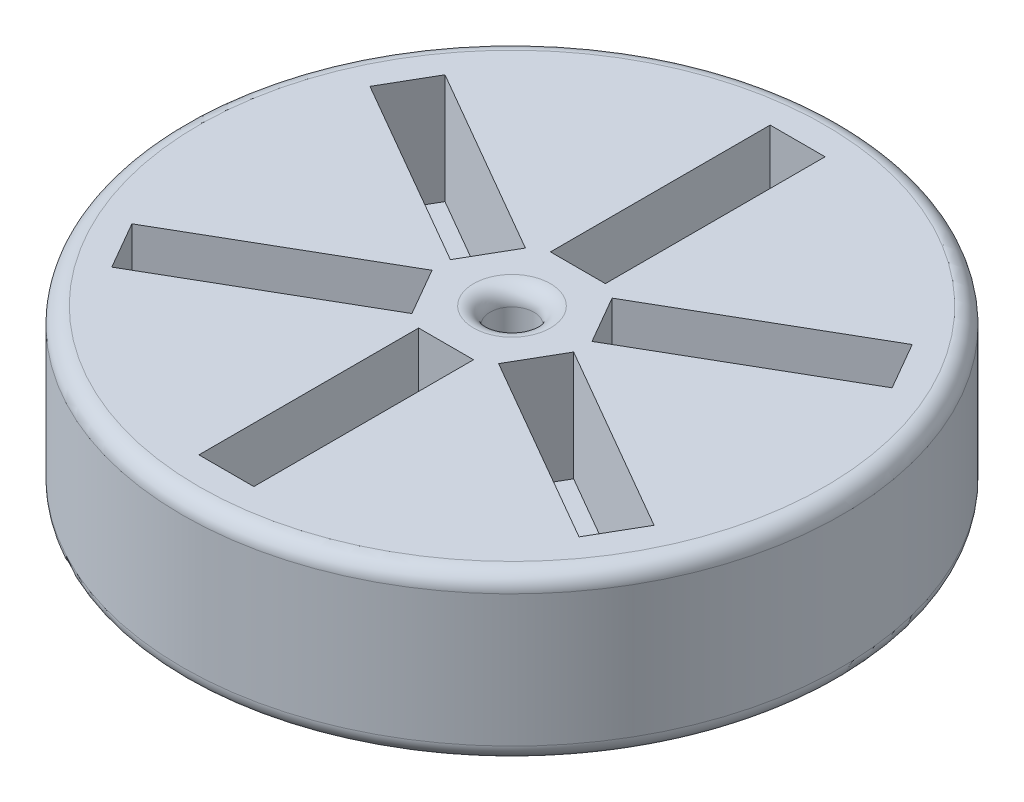
from build123d import *

# Parameters (mm, degrees)
SKETCH2_R           = 30
BOSS_EXTRUDE1_DEPTH = 15
SKETCH3_R           = 2
CUT_EXTRUDE1_DEPTH  = 9
FILLET1_R           = 1.5
CUT_EXTRUDE2_DEPTH  = 1
SKETCH5_W           = 5
SKETCH5_H           = 20
CUT_EXTRUDE3_DEPTH  = 10
CIRPATTERN1_COUNT   = 6


with BuildPart() as part:
    # Sketch2 → Boss-Extrude1 (new body)
    with BuildSketch(Plane(origin=(0, 0, 0), x_dir=(1, 0, 0), z_dir=(0, 1, 0))):
        Circle(SKETCH2_R)
    extrude(amount=BOSS_EXTRUDE1_DEPTH)

    # Sketch3 → Cut-Extrude1 (cut)
    with BuildSketch(Plane(origin=(0, 15, 0), x_dir=(1, 0, 0), z_dir=(0, 1, 0))):
        Circle(SKETCH3_R)
    extrude(amount=-CUT_EXTRUDE1_DEPTH, mode=Mode.SUBTRACT)

    # Fillet1
    fillet1_edges = [part.edges().sort_by_distance(p)[0] for p in [
        (-2, 15, 0),
        (-30, 0, 0),
        (-30, 15, 0),
    ]]
    fillet(fillet1_edges, radius=FILLET1_R)

    # Sketch4 → Cut-Extrude2 (cut)
    with BuildSketch(Plane.XZ):
        Polygon((-0.5, 17), (-0.5, -27.5), (0.5, -27.5), (0.5, 17), (10.5, 17), (0, 27.5), (-10.5, 17), align=None)
    extrude(amount=-CUT_EXTRUDE2_DEPTH, mode=Mode.SUBTRACT)

    # Sketch5 → Cut-Extrude3 (cut)
    with BuildSketch(Plane(origin=(0, 15, 0), x_dir=(1, 0, 0), z_dir=(0, 1, 0))):
        with Locations((0, 16)):
            Rectangle(SKETCH5_W, SKETCH5_H)
    cut_extrude3 = extrude(amount=-CUT_EXTRUDE3_DEPTH, mode=Mode.SUBTRACT)

    # CirPattern1: Cut-Extrude3 ×6 about axis
    cirpattern1_axis = Axis((0, 6, 0), (0, 1, 0))
    for i in range(1, CIRPATTERN1_COUNT):
        add(cut_extrude3.rotate(cirpattern1_axis, i * 360 / CIRPATTERN1_COUNT), mode=Mode.SUBTRACT)


solid = part.part
